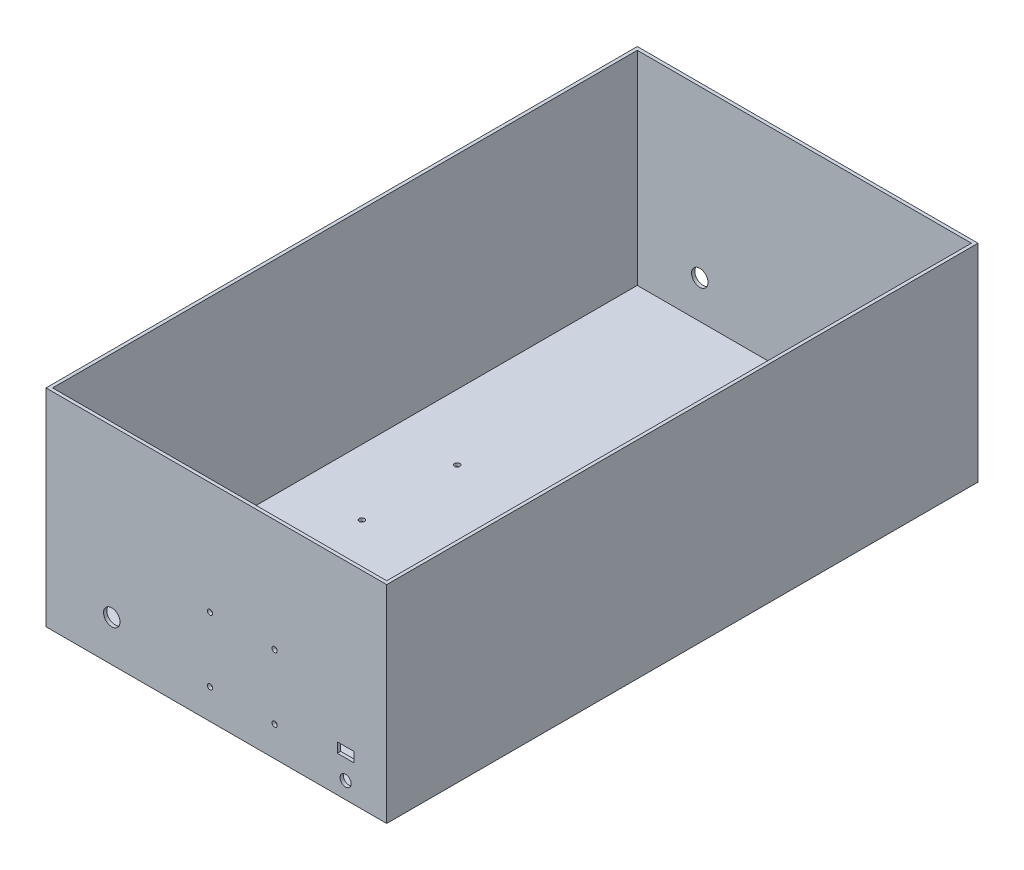
from build123d import *

# Parameters (mm, degrees)
SKETCH2_W               = 207.2
SKETCH2_H               = 359.6
SKETCH2_W_2             = 203.2
SKETCH2_H_2             = 355.6
WALLS_DEPTH             = 123.825
SKETCH3_W               = 207.2
SKETCH3_H               = 359.6
BASE_DEPTH              = 2
SKETCH4_R               = 5
SKETCH4_W               = 10
SKETCH4_H               = 6
CUT_EXTRUDE1_DEPTH      = 395.179845534
SKETCH5_R               = 3.3782
CUT_EXTRUDE2_DEPTH      = 395.179845534
F_1_4_CLEARANCE_HOLE1_D = 6.7564
CUT_EXTRUDE3_REACH      = 244.679
SKETCH9_R               = 1.6
CUT_EXTRUDE4_REACH      = 396.18
SKETCH10_R              = 1.6


with BuildPart() as part:
    # Sketch2 → Walls (new body)
    with BuildSketch(Plane(origin=(0, 0, 0), x_dir=(1, 0, 0), z_dir=(0, 1, 0))):
        Rectangle(SKETCH2_W, SKETCH2_H)
        Rectangle(SKETCH2_W_2, SKETCH2_H_2, mode=Mode.SUBTRACT)
    extrude(amount=WALLS_DEPTH)

    # Sketch3 → Base (add)
    with BuildSketch(Plane.XZ):
        Rectangle(SKETCH3_W, SKETCH3_H)
    extrude(amount=BASE_DEPTH)

    # Sketch4 → Cut-Extrude1 (cut, through all)
    with BuildSketch(Plane(origin=(0, 0, -179.8), x_dir=(-1, 0, 0), z_dir=(0, 0, -1))):
        with Locations((63.6, 23)):
            Circle(SKETCH4_R)
        with Locations((-78.6, 23)):
            Rectangle(SKETCH4_W, SKETCH4_H)
    extrude(amount=-CUT_EXTRUDE1_DEPTH, mode=Mode.SUBTRACT)

    # Sketch5 → Cut-Extrude2 (cut, through all)
    with BuildSketch(Plane(origin=(0, 0, -179.8), x_dir=(-1, 0, 0), z_dir=(0, 0, -1))):
        with Locations((-78.6, 8.09625)):
            Circle(SKETCH5_R)
    extrude(amount=-CUT_EXTRUDE2_DEPTH, mode=Mode.SUBTRACT)

    # 1/4 Clearance Hole1 (through all)
    with Locations(Plane(origin=(0, -2, 0), x_dir=(-1, 0, 0), z_dir=(0, -1, 0))):
        with Locations((-27, 0), (-5, 0)):
            Hole(F_1_4_CLEARANCE_HOLE1_D / 2)

    # Sketch9 → Cut-Extrude3 (cut, up to next)
    with BuildSketch(Plane.XZ.offset(2), mode=Mode.PRIVATE) as cut_extrude3_sk1:
        with Locations((92, 61.675)):
            Circle(SKETCH9_R)
    cut_extrude3_tool1 = extrude(cut_extrude3_sk1.sketch, amount=-CUT_EXTRUDE3_REACH, mode=Mode.PRIVATE) & part.part
    # Sketch9 → Cut-Extrude3 (cut, up to next)
    with BuildSketch(Plane.XZ.offset(2), mode=Mode.PRIVATE) as cut_extrude3_sk2:
        with Locations((92, -61.675)):
            Circle(SKETCH9_R)
    cut_extrude3_tool2 = extrude(cut_extrude3_sk2.sketch, amount=-CUT_EXTRUDE3_REACH, mode=Mode.PRIVATE) & part.part
    # Sketch9 → Cut-Extrude3 (cut, up to next)
    with BuildSketch(Plane.XZ.offset(2), mode=Mode.PRIVATE) as cut_extrude3_sk3:
        with Locations((49, 61.675)):
            Circle(SKETCH9_R)
    cut_extrude3_tool3 = extrude(cut_extrude3_sk3.sketch, amount=-CUT_EXTRUDE3_REACH, mode=Mode.PRIVATE) & part.part
    # Sketch9 → Cut-Extrude3 (cut, up to next)
    with BuildSketch(Plane.XZ.offset(2), mode=Mode.PRIVATE) as cut_extrude3_sk4:
        with Locations((49, -61.675)):
            Circle(SKETCH9_R)
    cut_extrude3_tool4 = extrude(cut_extrude3_sk4.sketch, amount=-CUT_EXTRUDE3_REACH, mode=Mode.PRIVATE) & part.part
    # Sketch9 → Cut-Extrude3 (cut, up to next)
    with BuildSketch(Plane.XZ.offset(2), mode=Mode.PRIVATE) as cut_extrude3_sk5:
        with Locations((27.150599532, -126.77942842)):
            Circle(SKETCH9_R)
    cut_extrude3_tool5 = extrude(cut_extrude3_sk5.sketch, amount=-CUT_EXTRUDE3_REACH, mode=Mode.PRIVATE) & part.part
    # Sketch9 → Cut-Extrude3 (cut, up to next)
    with BuildSketch(Plane.XZ.offset(2), mode=Mode.PRIVATE) as cut_extrude3_sk6:
        with Locations((27.150599532, -166.07942842)):
            Circle(SKETCH9_R)
    cut_extrude3_tool6 = extrude(cut_extrude3_sk6.sketch, amount=-CUT_EXTRUDE3_REACH, mode=Mode.PRIVATE) & part.part
    # Sketch9 → Cut-Extrude3 (cut, up to next)
    with BuildSketch(Plane.XZ.offset(2), mode=Mode.PRIVATE) as cut_extrude3_sk7:
        with Locations((-12.149400468, -126.77942842)):
            Circle(SKETCH9_R)
    cut_extrude3_tool7 = extrude(cut_extrude3_sk7.sketch, amount=-CUT_EXTRUDE3_REACH, mode=Mode.PRIVATE) & part.part
    # Sketch9 → Cut-Extrude3 (cut, up to next)
    with BuildSketch(Plane.XZ.offset(2), mode=Mode.PRIVATE) as cut_extrude3_sk8:
        with Locations((-12.149400468, -166.07942842)):
            Circle(SKETCH9_R)
    cut_extrude3_tool8 = extrude(cut_extrude3_sk8.sketch, amount=-CUT_EXTRUDE3_REACH, mode=Mode.PRIVATE) & part.part
    # Sketch9 → Cut-Extrude3 (cut, up to next)
    with BuildSketch(Plane.XZ.offset(2), mode=Mode.PRIVATE) as cut_extrude3_sk9:
        with Locations((23.972842929, -62.905516645)):
            Circle(SKETCH9_R)
    cut_extrude3_tool9 = extrude(cut_extrude3_sk9.sketch, amount=-CUT_EXTRUDE3_REACH, mode=Mode.PRIVATE) & part.part
    # Sketch9 → Cut-Extrude3 (cut, up to next)
    with BuildSketch(Plane.XZ.offset(2), mode=Mode.PRIVATE) as cut_extrude3_sk10:
        with Locations((23.972842929, -83.205516645)):
            Circle(SKETCH9_R)
    cut_extrude3_tool10 = extrude(cut_extrude3_sk10.sketch, amount=-CUT_EXTRUDE3_REACH, mode=Mode.PRIVATE) & part.part
    # Sketch9 → Cut-Extrude3 (cut, up to next)
    with BuildSketch(Plane.XZ.offset(2), mode=Mode.PRIVATE) as cut_extrude3_sk11:
        with Locations((3.672842929, -62.905516645)):
            Circle(SKETCH9_R)
    cut_extrude3_tool11 = extrude(cut_extrude3_sk11.sketch, amount=-CUT_EXTRUDE3_REACH, mode=Mode.PRIVATE) & part.part
    # Sketch9 → Cut-Extrude3 (cut, up to next)
    with BuildSketch(Plane.XZ.offset(2), mode=Mode.PRIVATE) as cut_extrude3_sk12:
        with Locations((3.672842929, -83.205516645)):
            Circle(SKETCH9_R)
    cut_extrude3_tool12 = extrude(cut_extrude3_sk12.sketch, amount=-CUT_EXTRUDE3_REACH, mode=Mode.PRIVATE) & part.part
    # Sketch9 → Cut-Extrude3 (cut, up to next)
    with BuildSketch(Plane.XZ.offset(2), mode=Mode.PRIVATE) as cut_extrude3_sk13:
        with Locations((-12.790807995, 29.507114508)):
            Circle(SKETCH9_R)
    cut_extrude3_tool13 = extrude(cut_extrude3_sk13.sketch, amount=-CUT_EXTRUDE3_REACH, mode=Mode.PRIVATE) & part.part
    # Sketch9 → Cut-Extrude3 (cut, up to next)
    with BuildSketch(Plane.XZ.offset(2), mode=Mode.PRIVATE) as cut_extrude3_sk14:
        with Locations((-12.790807995, -28.492885492)):
            Circle(SKETCH9_R)
    cut_extrude3_tool14 = extrude(cut_extrude3_sk14.sketch, amount=-CUT_EXTRUDE3_REACH, mode=Mode.PRIVATE) & part.part
    # Sketch9 → Cut-Extrude3 (cut, up to next)
    with BuildSketch(Plane.XZ.offset(2), mode=Mode.PRIVATE) as cut_extrude3_sk15:
        with Locations((-61.790807995, -28.492885492)):
            Circle(SKETCH9_R)
    cut_extrude3_tool15 = extrude(cut_extrude3_sk15.sketch, amount=-CUT_EXTRUDE3_REACH, mode=Mode.PRIVATE) & part.part
    # Sketch9 → Cut-Extrude3 (cut, up to next)
    with BuildSketch(Plane.XZ.offset(2), mode=Mode.PRIVATE) as cut_extrude3_sk16:
        with Locations((-61.790807995, 29.507114508)):
            Circle(SKETCH9_R)
    cut_extrude3_tool16 = extrude(cut_extrude3_sk16.sketch, amount=-CUT_EXTRUDE3_REACH, mode=Mode.PRIVATE) & part.part
    # Sketch9 → Cut-Extrude3 (cut, up to next)
    with BuildSketch(Plane.XZ.offset(2), mode=Mode.PRIVATE) as cut_extrude3_sk17:
        with Locations((-51.497087804, 74.997613979)):
            Circle(SKETCH9_R)
    cut_extrude3_tool17 = extrude(cut_extrude3_sk17.sketch, amount=-CUT_EXTRUDE3_REACH, mode=Mode.PRIVATE) & part.part
    # Sketch9 → Cut-Extrude3 (cut, up to next)
    with BuildSketch(Plane.XZ.offset(2), mode=Mode.PRIVATE) as cut_extrude3_sk18:
        with Locations((-12.197087804, 74.997613979)):
            Circle(SKETCH9_R)
    cut_extrude3_tool18 = extrude(cut_extrude3_sk18.sketch, amount=-CUT_EXTRUDE3_REACH, mode=Mode.PRIVATE) & part.part
    # Sketch9 → Cut-Extrude3 (cut, up to next)
    with BuildSketch(Plane.XZ.offset(2), mode=Mode.PRIVATE) as cut_extrude3_sk19:
        with Locations((-12.197087804, 114.297613979)):
            Circle(SKETCH9_R)
    cut_extrude3_tool19 = extrude(cut_extrude3_sk19.sketch, amount=-CUT_EXTRUDE3_REACH, mode=Mode.PRIVATE) & part.part
    # Sketch9 → Cut-Extrude3 (cut, up to next)
    with BuildSketch(Plane.XZ.offset(2), mode=Mode.PRIVATE) as cut_extrude3_sk20:
        with Locations((-51.497087804, 114.297613979)):
            Circle(SKETCH9_R)
    cut_extrude3_tool20 = extrude(cut_extrude3_sk20.sketch, amount=-CUT_EXTRUDE3_REACH, mode=Mode.PRIVATE) & part.part
    add(cut_extrude3_tool1.solids().sort_by_distance((92, -2, 61.675))[0], mode=Mode.SUBTRACT)
    add(cut_extrude3_tool2.solids().sort_by_distance((92, -2, -61.675))[0], mode=Mode.SUBTRACT)
    add(cut_extrude3_tool3.solids().sort_by_distance((49, -2, 61.675))[0], mode=Mode.SUBTRACT)
    add(cut_extrude3_tool4.solids().sort_by_distance((49, -2, -61.675))[0], mode=Mode.SUBTRACT)
    add(cut_extrude3_tool5.solids().sort_by_distance((27.1506, -2, -126.779428))[0], mode=Mode.SUBTRACT)
    add(cut_extrude3_tool6.solids().sort_by_distance((27.1506, -2, -166.079428))[0], mode=Mode.SUBTRACT)
    add(cut_extrude3_tool7.solids().sort_by_distance((-12.1494, -2, -126.779428))[0], mode=Mode.SUBTRACT)
    add(cut_extrude3_tool8.solids().sort_by_distance((-12.1494, -2, -166.079428))[0], mode=Mode.SUBTRACT)
    add(cut_extrude3_tool9.solids().sort_by_distance((23.972843, -2, -62.905517))[0], mode=Mode.SUBTRACT)
    add(cut_extrude3_tool10.solids().sort_by_distance((23.972843, -2, -83.205517))[0], mode=Mode.SUBTRACT)
    add(cut_extrude3_tool11.solids().sort_by_distance((3.672843, -2, -62.905517))[0], mode=Mode.SUBTRACT)
    add(cut_extrude3_tool12.solids().sort_by_distance((3.672843, -2, -83.205517))[0], mode=Mode.SUBTRACT)
    add(cut_extrude3_tool13.solids().sort_by_distance((-12.790808, -2, 29.507115))[0], mode=Mode.SUBTRACT)
    add(cut_extrude3_tool14.solids().sort_by_distance((-12.790808, -2, -28.492885))[0], mode=Mode.SUBTRACT)
    add(cut_extrude3_tool15.solids().sort_by_distance((-61.790808, -2, -28.492885))[0], mode=Mode.SUBTRACT)
    add(cut_extrude3_tool16.solids().sort_by_distance((-61.790808, -2, 29.507115))[0], mode=Mode.SUBTRACT)
    add(cut_extrude3_tool17.solids().sort_by_distance((-51.497088, -2, 74.997614))[0], mode=Mode.SUBTRACT)
    add(cut_extrude3_tool18.solids().sort_by_distance((-12.197088, -2, 74.997614))[0], mode=Mode.SUBTRACT)
    add(cut_extrude3_tool19.solids().sort_by_distance((-12.197088, -2, 114.297614))[0], mode=Mode.SUBTRACT)
    add(cut_extrude3_tool20.solids().sort_by_distance((-51.497088, -2, 114.297614))[0], mode=Mode.SUBTRACT)

    # Sketch10 → Cut-Extrude4 (cut, up to next)
    with BuildSketch(Plane.XY.offset(179.8), mode=Mode.PRIVATE) as cut_extrude4_sk1:
        with Locations((-3.883568738, 55.54507545)):
            Circle(SKETCH10_R)
    cut_extrude4_tool1 = extrude(cut_extrude4_sk1.sketch, amount=-CUT_EXTRUDE4_REACH, mode=Mode.PRIVATE) & part.part
    # Sketch10 → Cut-Extrude4 (cut, up to next)
    with BuildSketch(Plane.XY.offset(179.8), mode=Mode.PRIVATE) as cut_extrude4_sk2:
        with Locations((35.416431262, 55.54507545)):
            Circle(SKETCH10_R)
    cut_extrude4_tool2 = extrude(cut_extrude4_sk2.sketch, amount=-CUT_EXTRUDE4_REACH, mode=Mode.PRIVATE) & part.part
    # Sketch10 → Cut-Extrude4 (cut, up to next)
    with BuildSketch(Plane.XY.offset(179.8), mode=Mode.PRIVATE) as cut_extrude4_sk3:
        with Locations((35.416431262, 16.24507545)):
            Circle(SKETCH10_R)
    cut_extrude4_tool3 = extrude(cut_extrude4_sk3.sketch, amount=-CUT_EXTRUDE4_REACH, mode=Mode.PRIVATE) & part.part
    # Sketch10 → Cut-Extrude4 (cut, up to next)
    with BuildSketch(Plane.XY.offset(179.8), mode=Mode.PRIVATE) as cut_extrude4_sk4:
        with Locations((-3.883568738, 16.24507545)):
            Circle(SKETCH10_R)
    cut_extrude4_tool4 = extrude(cut_extrude4_sk4.sketch, amount=-CUT_EXTRUDE4_REACH, mode=Mode.PRIVATE) & part.part
    add(cut_extrude4_tool1.solids().sort_by_distance((-3.883569, 55.545075, 179.8))[0], mode=Mode.SUBTRACT)
    add(cut_extrude4_tool2.solids().sort_by_distance((35.416431, 55.545075, 179.8))[0], mode=Mode.SUBTRACT)
    add(cut_extrude4_tool3.solids().sort_by_distance((35.416431, 16.245075, 179.8))[0], mode=Mode.SUBTRACT)
    add(cut_extrude4_tool4.solids().sort_by_distance((-3.883569, 16.245075, 179.8))[0], mode=Mode.SUBTRACT)


solid = part.part
